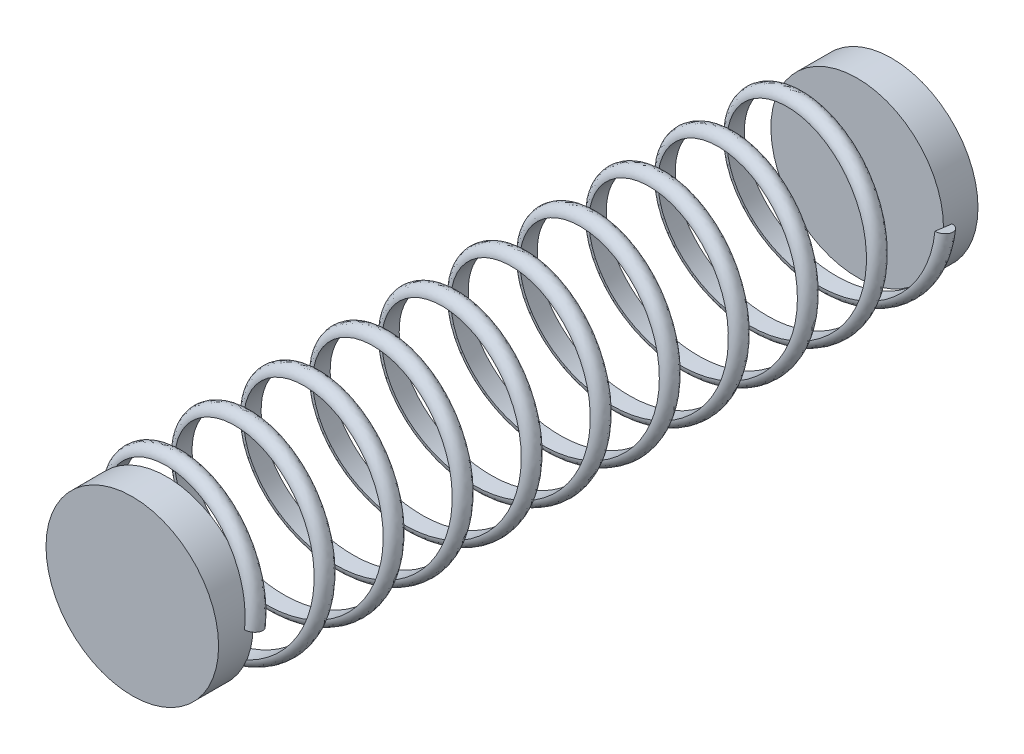
from build123d import *

# Parameters (mm, degrees)
SWEEP_1_PITCH        = 4
SWEEP_1_HEIGHT       = 40
SWEEP_1_RADIUS       = 5
SWEEP_1_PROFILE_R    = 0.5
EXTRUDE_1_DEPTH      = 42
EXTRUDE_1_DEPTH_BACK = 2
SKETCH_15_R          = 5
SKETCH_16_R          = 5
CUT_EXTRUDE_1_DEPTH  = 40


with BuildPart() as part:
    # 扫描1: sweep along a helix
    with BuildLine() as sweep_1_path:
        Helix(SWEEP_1_PITCH, SWEEP_1_HEIGHT, SWEEP_1_RADIUS, center=(0, 0, 0), direction=(0, 0, 1), lefthand=True)
    # 扫描1 profile (on start of the path) → 扫描1 (sweep)
    with BuildSketch(Plane(origin=(5, 0, 0), x_dir=(0, -0.1263042864341272, -0.9919915459460156), z_dir=(-3.7602329341723987e-13, -0.9919915459460156, 0.1263042864341272))):
        Circle(SWEEP_1_PROFILE_R)
    sweep(path=sweep_1_path.line, is_frenet=True)

    # 草图15 → 凸台-拉伸1 (add, two sides: drawn at the far end of the back side and taken through both)
    with BuildSketch(Plane.XY.offset(-EXTRUDE_1_DEPTH_BACK)):
        Circle(SKETCH_15_R)
    extrude(amount=EXTRUDE_1_DEPTH + EXTRUDE_1_DEPTH_BACK)

    # 草图16 → 切除-拉伸1 (cut)
    with BuildSketch(Plane.XY):
        Circle(SKETCH_16_R)
    extrude(amount=CUT_EXTRUDE_1_DEPTH, mode=Mode.SUBTRACT)


solid = part.part
